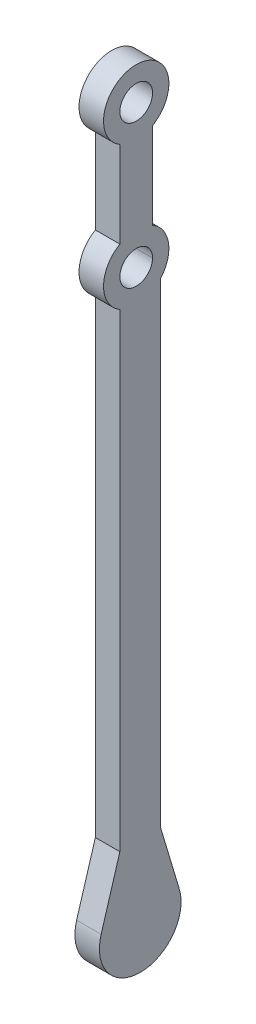
from build123d import *

# Parameters (mm, degrees)
ESQUISSE1_W         = 3
ESQUISSE1_H         = 5
BOSS_EXTRU_1_DEPTH  = 65
BOSS_EXTRUDE1_START = -3
BOSS_EXTRUDE1_DEPTH = 3
ESQUISSE3_R         = 2
BOSS_EXTRUDE3_DEPTH = 3
ESQUISSE3_10_R      = 2
CUT_EXTRUDE2_DEPTH  = 10


# Read off the part's stored shape, not the designer's step: Boss-Extrude1
with BuildPart() as part:
    # Esquisse1 → Boss.-Extru.1 (new body)
    with BuildSketch(Plane(origin=(0, 0, 0), x_dir=(1, 0, 0), z_dir=(0, 1, 0))):
        Rectangle(ESQUISSE1_W, ESQUISSE1_H)
    extrude(amount=BOSS_EXTRU_1_DEPTH)

    # Boss-Extrude1 outline → Boss-Extrude1 (add)
    with BuildSketch(Plane.ZY.offset(1.5).offset(BOSS_EXTRUDE1_START)):
        with BuildLine():
            Line((4.792700519, -3.558056958), (2.5, 4.054226947))
            Line((2.5, 4.054226947), (2.5, 0))
            Line((2.5, 0), (-2.5, 0))
            Line((-2.5, 0), (-2.5, 4.054226947))
            Line((-2.5, 4.054226947), (-4.784214598, -3.563976926))
            ThreePointArc((-4.784214598, -3.563976926), (0.008223214, -9.999996411), (4.792700519, -3.558056958))
        make_face()
    extrude(amount=BOSS_EXTRUDE1_DEPTH)

    # Esquisse3 → Boss-Extrude3 (add, through all)
    with BuildSketch(Plane.ZY.offset(1.5)):
        with BuildLine():
            ThreePointArc((2.5, 79.034286522), (0.5, 86.498388137), (-1.5, 79.034286522))
            Line((-1.5, 79.034286522), (-1.5, 68.462489753))
            ThreePointArc((-1.5, 68.462489753), (0.5, 60.998388137), (2.5, 68.462489753))
            Line((2.5, 68.462489753), (2.5, 79.034286522))
        make_face()
        with Locations((0.5, 82.498388137)):
            Circle(ESQUISSE3_R, mode=Mode.SUBTRACT)
        with Locations((0.5, 64.998388137)):
            Circle(ESQUISSE3_R, mode=Mode.SUBTRACT)
    extrude(amount=-BOSS_EXTRUDE3_DEPTH)

    # Esquisse3<10> → Cut-Extrude2 (cut)
    with BuildSketch(Plane.ZY.offset(1.5)):
        with Locations((0.5, 64.998388137)):
            Circle(ESQUISSE3_10_R)
    extrude(amount=-CUT_EXTRUDE2_DEPTH, mode=Mode.SUBTRACT)


solid = part.part
